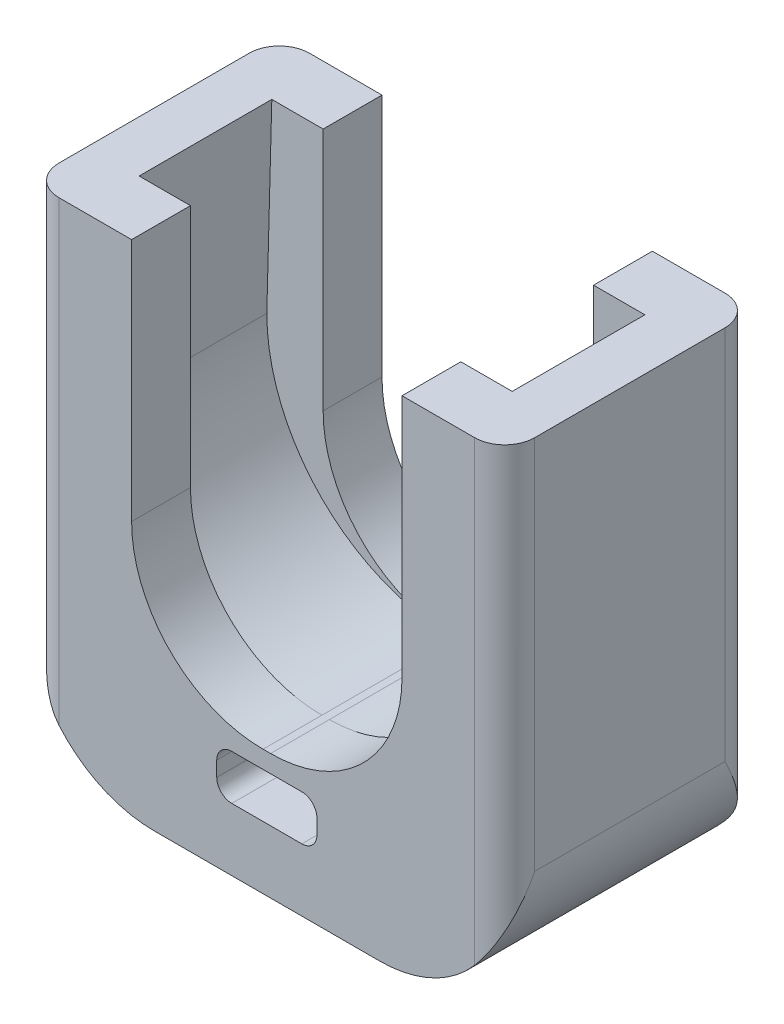
from build123d import *

# Parameters (mm, degrees)
SKETCH1_W                      = 24.13
SKETCH1_H                      = 12.7
BOSS_EXTRUDE1_DEPTH            = 25.4
CUT_EXTRUDE2_DEPTH             = 19.05
FILLET1_R                      = 9.525
FILLET2_R                      = 6.6675
BOSS_EXTRUDE2_DEPTH            = 3.3655
CUT_EXTRUDE3_REACH             = 39.265
SKETCH4_W                      = 5.08
SKETCH4_H                      = 2.286
CUT_EXTRUDE3_DIRECTION_2_DEPTH = 38.265357908
FILLET3_R                      = 0.762
FILLET4_R                      = 1.524
FILLET5_R                      = 6.35


# Some blends are built 0.0001 mm under size
with BuildPart() as part:
    # Sketch1 → Boss-Extrude1 (new body)
    with BuildSketch(Plane(origin=(0, 0, 0), x_dir=(1, 0, 0), z_dir=(0, 1, 0))):
        with Locations((12.065, 6.35)):
            Rectangle(SKETCH1_W, SKETCH1_H)
    extrude(amount=BOSS_EXTRUDE1_DEPTH)

    # Sketch2 → Cut-Extrude2 (cut)
    with BuildSketch(Plane(origin=(0, 25.4, 0), x_dir=(1, 0, 0), z_dir=(0, 1, 0))):
        Polygon((2.3495, 2.9845), (5.207, 2.9845), (5.207, 0), (18.923, 0), (18.923, 2.9845), (21.7805, 2.9845), (21.7805, 9.7155), (18.923, 9.7155), (18.923, 12.7), (5.207, 12.7), (5.207, 9.7155), (2.3495, 9.7155), align=None)
    extrude(amount=-CUT_EXTRUDE2_DEPTH, mode=Mode.SUBTRACT)

    # Fillet1
    fillet1_edges = [part.edges().sort_by_distance(p)[0] for p in [
        (21.7805, 6.35, -6.35),
        (2.3495, 6.35, -6.35),
    ]]
    fillet(fillet1_edges, radius=FILLET1_R)

    # Fillet2
    fillet2_edges = [part.edges().sort_by_distance(p)[0] for p in [
        (5.207, 9.072789422, -11.20775),
        (18.923, 9.072789422, -11.20775),
        (18.923, 9.072789422, -1.49225),
        (5.207, 9.072789422, -1.49225),
    ]]
    fillet(fillet2_edges, radius=FILLET2_R - 0.0001)  # a hair under: the kernel refuses the full size

    # Sketch3 → Boss-Extrude2 (add, symmetric)
    with BuildSketch(Plane.XY.offset(-6.35)):
        Polygon((21.7805, 25.4), (21.5265, 25.4), (21.7805, 15.875), align=None)
        Polygon((2.3495, 25.4), (2.6035, 25.4), (2.3495, 15.875), align=None)
    extrude(amount=BOSS_EXTRUDE2_DEPTH, both=True)

    # Sketch4 → Cut-Extrude3 (cut, up to next)
    with BuildSketch(Plane.XY, mode=Mode.PRIVATE) as cut_extrude3_sk1:
        with Locations((12.065, 4.318)):
            Rectangle(SKETCH4_W, SKETCH4_H)
    cut_extrude3_tool1 = extrude(cut_extrude3_sk1.sketch, amount=-CUT_EXTRUDE3_REACH, mode=Mode.PRIVATE) & part.part
    add(cut_extrude3_tool1.solids().sort_by_distance((12.065, 4.318, 0))[0], mode=Mode.SUBTRACT)

    # Sketch4 → Cut-Extrude3 direction 2 (cut)
    with BuildSketch(Plane.XY):
        with Locations((12.065, 4.318)):
            Rectangle(SKETCH4_W, SKETCH4_H)
    extrude(amount=CUT_EXTRUDE3_DIRECTION_2_DEPTH, mode=Mode.SUBTRACT)

    # Fillet3
    fillet3_edges = [part.edges().sort_by_distance(p)[0] for p in [
        (9.525, 5.461, -6.35),
        (9.525, 3.175, -6.35),
        (14.605, 3.175, -6.35),
        (14.605, 5.461, -6.35),
    ]]
    fillet(fillet3_edges, radius=FILLET3_R)

    # Fillet4
    fillet4_edges = [part.edges().sort_by_distance(p)[0] for p in [
        (0, 12.7, -12.7),
        (24.13, 12.7, -12.7),
        (24.13, 12.7, 0),
        (0, 12.7, 0),
    ]]
    fillet(fillet4_edges, radius=FILLET4_R)

    # Fillet5
    # the kernel refuses this fillet: 6.35 mm, written as the material it takes off along each edge
    with BuildSketch(Plane(origin=(24.13, 0, 14.351), x_dir=(-1, 0, 0), z_dir=(0, 0, -1)), Plane(origin=(0, 0, -27.051), x_dir=(1, 0, 0), z_dir=(0, 0, 1))) as fillet5_piece_1:
        with BuildLine():
            CenterArc((FILLET5_R, FILLET5_R), FILLET5_R, 180, 90)
            Line((0, FILLET5_R), (0, 0))
            Line((0, 0), (FILLET5_R, 0))
        make_face()
    extrude(amount=41.402, mode=Mode.SUBTRACT)


solid = part.part
